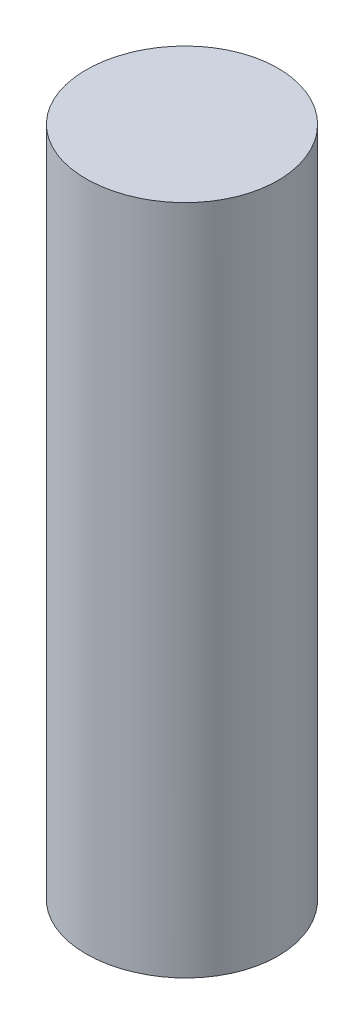
from build123d import *

# Parameters (mm, degrees)
SKETCH1_R           = 1.5875
BOSS_EXTRUDE1_DEPTH = 6.35
CUT_EXTRUDE1_START  = -3
CUT_EXTRUDE1_DEPTH  = 6


with BuildPart() as part:
    # Sketch1 → Boss-Extrude1 (new, symmetric)
    with BuildSketch(Plane(origin=(0, 0, 0), x_dir=(1, 0, 0), z_dir=(0, 1, 0))):
        with Locations(Location((0, 0, 0), (0, 0, 270))):
            Circle(SKETCH1_R)
    extrude(amount=BOSS_EXTRUDE1_DEPTH, both=True)

    # Cut-Extrude1: read off the stored shape, not the designer's step
    # Cut-Extrude1 outline → Cut-Extrude1 (cut)
    with BuildSketch(Plane.XY.offset(CUT_EXTRUDE1_START)):
        with BuildLine():
            Line((3, -5.559377759), (1.587612861, -5.502832997))
            ThreePointArc((1.587612861, -5.502832997), (1.372e-06, -5.471065769), (-1.587610119, -5.502832888))
            Line((-1.587610119, -5.502832888), (-3, -5.559377663))
            Line((-3, -5.559377663), (-3, -6.35))
            Line((-3, -6.35), (3, -6.35))
            Line((3, -6.35), (3, -5.559377759))
        make_face()
        with BuildLine():
            Line((1.587612812, 5.616619958), (3, 5.572458151))
            Line((3, 5.572458151), (3, 6.35))
            Line((3, 6.35), (-3, 6.35))
            Line((-3, 6.35), (-3, 5.572458224))
            Line((-3, 5.572458224), (-1.587610131, 5.616620041))
            ThreePointArc((-1.587610131, 5.616620041), (1.341e-06, 5.641434231), (1.587612812, 5.616619958))
        make_face()
    extrude(amount=CUT_EXTRUDE1_DEPTH, mode=Mode.SUBTRACT)


solid = part.part
